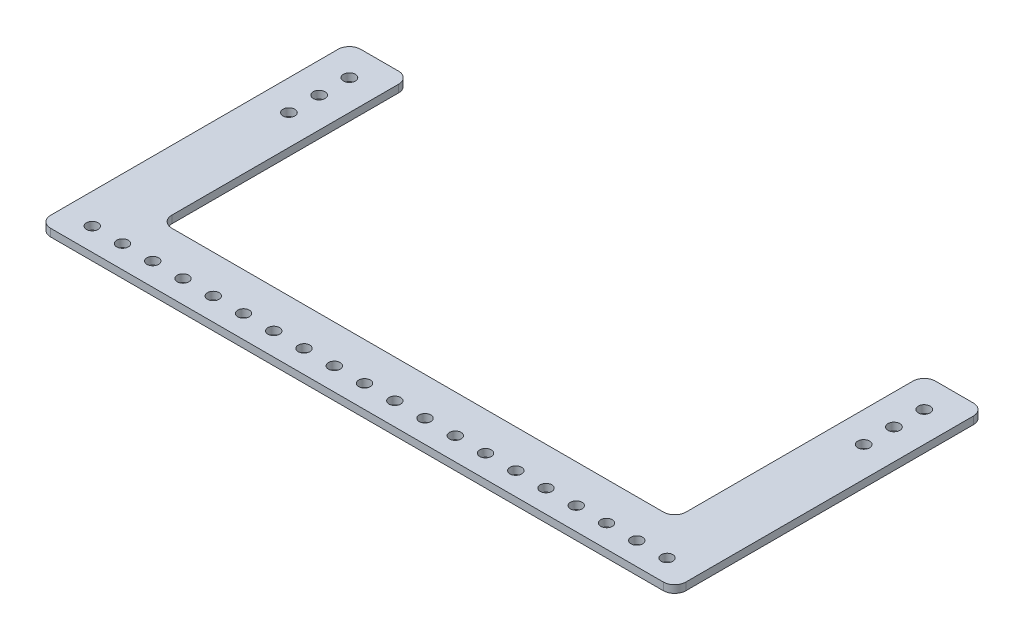
from build123d import *

# Parameters (mm, degrees)
SKETCH2_R           = 2.4892
BOSS_EXTRUDE1_DEPTH = 3.175
FILLET1_R           = 4.7625
SKETCH3_R           = 2.4384
CUT_EXTRUDE1_DEPTH  = 149.42063799


with BuildPart() as part:
    # Sketch2 → Boss-Extrude1 (new body)
    with BuildSketch(Plane(origin=(0, 0, 0), x_dir=(1, 0, 0), z_dir=(0, 1, 0))):
        Polygon((-133.35, 65.0875), (-133.35, -65.0875), (133.35, -65.0875), (133.35, 65.0875), (107.95, 65.0875), (107.95, -39.624), (-107.95, -39.624), (-107.95, 65.0875), align=None)
        with Locations((-120.65, 26.9875)):
            Circle(SKETCH2_R, mode=Mode.SUBTRACT)
        with Locations((-120.65, 39.6875)):
            Circle(SKETCH2_R, mode=Mode.SUBTRACT)
        with Locations((-120.65, 52.3875)):
            Circle(SKETCH2_R, mode=Mode.SUBTRACT)
        with Locations((120.65, 26.9875)):
            Circle(SKETCH2_R, mode=Mode.SUBTRACT)
        with Locations((120.65, 39.6875)):
            Circle(SKETCH2_R, mode=Mode.SUBTRACT)
        with Locations((120.65, 52.3875)):
            Circle(SKETCH2_R, mode=Mode.SUBTRACT)
    extrude(amount=BOSS_EXTRUDE1_DEPTH)

    # Fillet1
    fillet1_edges = [part.edges().sort_by_distance(p)[0] for p in [
        (133.35, 1.5875, -65.0875),
        (-133.35, 1.5875, 65.0875),
        (-133.35, 1.5875, -65.0875),
        (-107.95, 1.5875, -65.0875),
        (-107.95, 1.5875, 39.624),
        (107.95, 1.5875, 39.624),
        (107.95, 1.5875, -65.0875),
        (133.35, 1.5875, 65.0875),
    ]]
    fillet(fillet1_edges, radius=FILLET1_R)

    # Sketch3 → Cut-Extrude1 (cut, through all)
    with BuildSketch(Plane(origin=(0, 3.175, 0), x_dir=(1, 0, 0), z_dir=(0, 1, 0))):
        with Locations((-120.65, -55.5625)):
            Circle(SKETCH3_R)
        with Locations((-107.95, -55.5625)):
            Circle(SKETCH3_R)
        with Locations((-95.25, -55.5625)):
            Circle(SKETCH3_R)
        with Locations((-82.55, -55.5625)):
            Circle(SKETCH3_R)
        with Locations((-69.85, -55.5625)):
            Circle(SKETCH3_R)
        with Locations((-57.15, -55.5625)):
            Circle(SKETCH3_R)
        with Locations((-44.45, -55.5625)):
            Circle(SKETCH3_R)
        with Locations((-31.75, -55.5625)):
            Circle(SKETCH3_R)
        with Locations((-19.05, -55.5625)):
            Circle(SKETCH3_R)
        with Locations((-6.35, -55.5625)):
            Circle(SKETCH3_R)
        with Locations((6.35, -55.5625)):
            Circle(SKETCH3_R)
        with Locations((19.05, -55.5625)):
            Circle(SKETCH3_R)
        with Locations((31.75, -55.5625)):
            Circle(SKETCH3_R)
        with Locations((44.45, -55.5625)):
            Circle(SKETCH3_R)
        with Locations((57.15, -55.5625)):
            Circle(SKETCH3_R)
        with Locations((69.85, -55.5625)):
            Circle(SKETCH3_R)
        with Locations((82.55, -55.5625)):
            Circle(SKETCH3_R)
        with Locations((95.25, -55.5625)):
            Circle(SKETCH3_R)
        with Locations((107.95, -55.5625)):
            Circle(SKETCH3_R)
        with Locations((120.65, -55.5625)):
            Circle(SKETCH3_R)
    extrude(amount=-CUT_EXTRUDE1_DEPTH, mode=Mode.SUBTRACT)


solid = part.part
